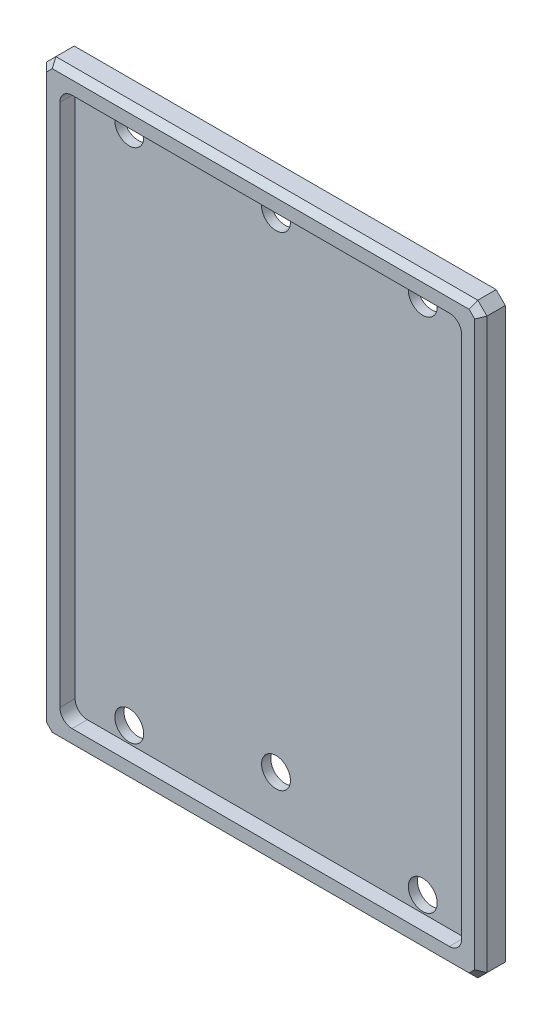
from build123d import *

# Parameters (mm, degrees)
SKETCH1_W                 = 228.6
SKETCH1_H                 = 304.8
BOSS_EXTRUDE1_DEPTH       = 12.7
CUT_EXTRUDE1_DEPTH        = 7.9375
SKETCH4_R                 = 7.5
CUT_EXTRUDE2_DEPTH        = 191.665292873
M4X0_7_TAPPED_HOLE1_D     = 3.3
M4X0_7_TAPPED_HOLE1_DEPTH = 5.4
M4X0_7_TAPPED_HOLE1_TIP   = 0.991420021
CHAMFER1_SIZE             = 4.7625
CHAMFER2_SIZE             = 3.175


with BuildPart() as part:
    # Sketch1 → Boss-Extrude1 (new body)
    with BuildSketch(Plane.XY):
        Rectangle(SKETCH1_W, SKETCH1_H)
    extrude(amount=BOSS_EXTRUDE1_DEPTH)

    # Sketch2 → Cut-Extrude1 (cut)
    with BuildSketch(Plane.XY.offset(12.7)):
        with BuildLine():
            Line((97.95, -142.4), (-97.95, -142.4))
            ThreePointArc((-97.95, -142.4), (-102.440128061, -140.540128061), (-104.3, -136.05))
            Line((-104.3, -136.05), (-104.3, 136.05))
            ThreePointArc((-104.3, 136.05), (-102.440128061, 140.540128061), (-97.95, 142.4))
            Line((-97.95, 142.4), (97.95, 142.4))
            ThreePointArc((97.95, 142.4), (102.440128061, 140.540128061), (104.3, 136.05))
            Line((104.3, 136.05), (104.3, -136.05))
            ThreePointArc((104.3, -136.05), (102.440128061, -140.540128061), (97.95, -142.4))
        make_face()
    extrude(amount=-CUT_EXTRUDE1_DEPTH, mode=Mode.SUBTRACT)

    # Sketch4 → Cut-Extrude2 (cut, through all)
    with BuildSketch(Plane.XY.offset(4.7625)):
        with Locations((-76.2, 134.05)):
            Circle(SKETCH4_R)
        with Locations((76.2, 134.05)):
            Circle(SKETCH4_R)
        with Locations((-76.2, -134.05)):
            Circle(SKETCH4_R)
        with Locations((76.2, -134.05)):
            Circle(SKETCH4_R)
        with Locations((0, 134.05)):
            Circle(SKETCH4_R)
        with Locations((0, -117)):
            Circle(SKETCH4_R)
    extrude(amount=-CUT_EXTRUDE2_DEPTH, mode=Mode.SUBTRACT)

    # M4x0.7 Tapped Hole1
    with Locations(Plane(origin=(0, 0, 0), x_dir=(-1, 0, 0), z_dir=(0, 0, -1))):
        with Locations((-109.3, -102.4), (-109.3, 0), (-109.3, 113.6)):
            Hole(M4X0_7_TAPPED_HOLE1_D / 2, depth=M4X0_7_TAPPED_HOLE1_DEPTH)
            with Locations((0, 0, -(M4X0_7_TAPPED_HOLE1_DEPTH + M4X0_7_TAPPED_HOLE1_TIP / 2))):  # 118° drill point
                Cone(0, M4X0_7_TAPPED_HOLE1_D / 2, M4X0_7_TAPPED_HOLE1_TIP, mode=Mode.SUBTRACT)

    # Chamfer1
    chamfer1_edges = [part.edges().sort_by_distance(p)[0] for p in [
        (-114.3, -152.4, 6.35),
        (114.3, -152.4, 6.35),
        (-114.3, 152.4, 6.35),
        (114.3, 152.4, 6.35),
    ]]
    chamfer(chamfer1_edges, length=CHAMFER1_SIZE)

    # Chamfer2
    chamfer2_edges = [part.edges().sort_by_distance(p)[0] for p in [
        (-111.91875, 150.01875, 12.7),
        (0, 152.4, 12.7),
        (111.91875, 150.01875, 12.7),
        (114.3, 0, 12.7),
        (111.91875, -150.01875, 12.7),
        (0, -152.4, 12.7),
        (-111.91875, -150.01875, 12.7),
        (-114.3, 0, 12.7),
    ]]
    chamfer(chamfer2_edges, length=CHAMFER2_SIZE)


solid = part.part
